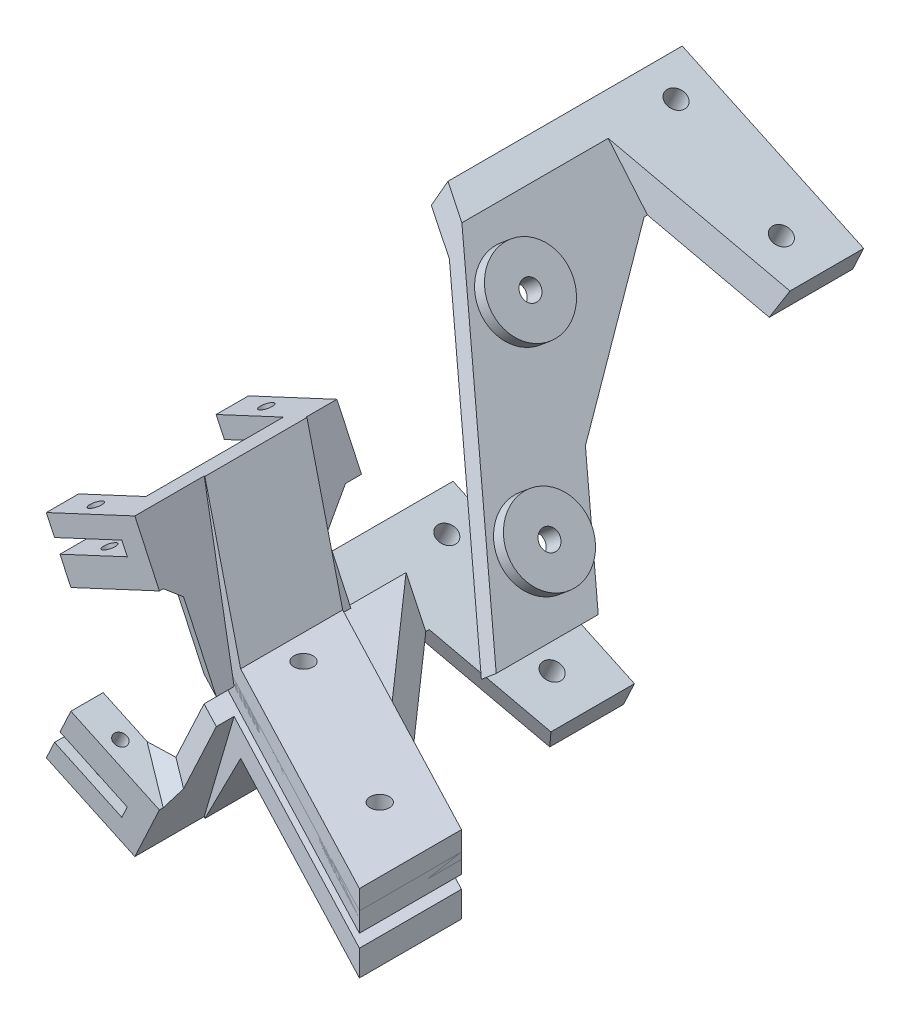
from build123d import *

# Parameters (mm, degrees)
BOSS_EXTRUDE1_DEPTH             = 3
SKETCH1_R                       = 6
BOSS_EXTRUDE3_DEPTH             = 2
SKETCH4_R                       = 1.5
CUT_EXTRUDE1_DEPTH              = 44.812962497
SKETCH5_R                       = 3.25
CUT_EXTRUDE2_DEPTH              = 2
SKETCH6_R                       = 1.5
BOSS_EXTRUDE4_DEPTH             = 4
CUT_EXTRUDE3_DEPTH              = 48.222467532
CUT_EXTRUDE3_DEPTH_BACK         = 48.222467532
SKETCH9_W                       = 15.125231148
SKETCH9_H                       = 5
SKETCH9_R                       = 1
BOSS_EXTRUDE6_DEPTH             = 4
SKETCH10_W                      = 3.625231148
SKETCH10_H                      = 31.3
BOSS_EXTRUDE7_DEPTH             = 2
SKETCH11_R                      = 1
BOSS_EXTRUDE8_DEPTH             = 3
CHAMFER2_SIZE                   = 4
CHAMFER3_SIZE                   = 2
CHAMFER4_SIZE                   = 4
CHAMFER4_SIZE_2                 = 20
BOSS_EXTRUDE9_DEPTH             = 36
BOSS_EXTRUDE9_DIRECTION_2_REACH = 51.204
SKETCH19_R                      = 3.25
CUT_EXTRUDE4_DEPTH              = 56.500838994
SKETCH20_R                      = 1.5
CUT_EXTRUDE5_DEPTH              = 56.500838994
BOSS_EXTRUDE10_DEPTH            = 11
CUT_EXTRUDE8_START              = -4
CUT_EXTRUDE8_OUTLINE_R          = 1.5
CUT_EXTRUDE8_DEPTH              = 4
CHAMFER5_SIZE                   = 5
CHAMFER5_SIZE_2                 = 12
CHAMFER6_SIZE                   = 8
CHAMFER6_SIZE_2                 = 10.199591319


# Read off the part's stored shape, not the designer's step: Cut-Extrude8
with BuildPart() as part:
    # Sketch3 → Boss-Extrude1 (new body)
    with BuildSketch(Plane(origin=(0, 0, 0), x_dir=(1, 0, 0), z_dir=(0, 1, 0))):
        Polygon((-10, 13.145588768), (-10, -2.661376867), (34.799193535, -26.145588768), (34.799193535, -10.338623133), align=None)
    extrude(amount=BOSS_EXTRUDE1_DEPTH)

    # Sketch1 → Boss-Extrude3 (add)
    with BuildSketch(Plane(origin=(0, 0, 0), x_dir=(1, 0, 0), z_dir=(0, 1, 0))):
        with Locations(Location((0, 0, 0), (0, 0, 270))):
            Circle(SKETCH1_R)
        with Locations(Location((24.799193535, -13, 0), (0, 0, 270))):
            Circle(SKETCH1_R)
    extrude(amount=-BOSS_EXTRUDE3_DEPTH)

    # Sketch4 → Cut-Extrude1 (cut, through all)
    with BuildSketch(Plane(origin=(0, 3, 0), x_dir=(1, 0, 0), z_dir=(0, 1, 0))):
        with Locations(Location((0, 0, 0), (0, 0, 270))):
            Circle(SKETCH4_R)
        with Locations(Location((24.799193535, -13, 0), (0, 0, 270))):
            Circle(SKETCH4_R)
    extrude(amount=-CUT_EXTRUDE1_DEPTH, mode=Mode.SUBTRACT)

    # Sketch5 → Cut-Extrude2 (cut)
    with BuildSketch(Plane(origin=(0, 3, 0), x_dir=(1, 0, 0), z_dir=(0, 1, 0))):
        with Locations(Location((0, 0, 0), (0, 0, 270))):
            Circle(SKETCH5_R)
        with Locations(Location((24.799193535, -13, 0), (0, 0, 270))):
            Circle(SKETCH5_R)
    extrude(amount=-CUT_EXTRUDE2_DEPTH, mode=Mode.SUBTRACT)

    # Sketch18 → Boss-Extrude9 (add)
    with BuildSketch(Plane.XY):
        Polygon((-10, 0), (-14.531538935, 2.113091309), (-12.841065888, 5.738322457), (-0.535193667, 0), align=None)
    extrude(amount=-BOSS_EXTRUDE9_DEPTH)

    # Boss-Extrude9 direction 2: up to this plane
    boss_extrude9_direction_2_end = Plane(origin=(-10, 3, 2.661376867), z_dir=(0.4642857142857141, 0, -0.8856854834026605))
    # Sketch18 → Boss-Extrude9 direction 2 (add, up to the surface)
    with BuildSketch(Plane.XY, mode=Mode.PRIVATE) as boss_extrude9_direction_2_sk1:
        Polygon((-10, 0), (-14.531538935, 2.113091309), (-12.841065888, 5.738322457), (-0.535193667, 0), align=None)
    boss_extrude9_direction_2_tool1 = split(extrude(boss_extrude9_direction_2_sk1.sketch, amount=BOSS_EXTRUDE9_DIRECTION_2_REACH, mode=Mode.PRIVATE), bisect_by=boss_extrude9_direction_2_end, keep=Keep.BOTH, mode=Mode.PRIVATE)
    add(boss_extrude9_direction_2_tool1.solids().sort_by_distance((-9.047723, 2.102343, 0))[0])

    # Sketch19 → Cut-Extrude4 (cut, through all)
    with BuildSketch(Plane(origin=(0, 1, 0), x_dir=(1, 0, 0), z_dir=(0, 1, 0))):
        with Locations(Location((0, 0, 0), (0, 0, 270))):
            Circle(SKETCH19_R)
    extrude(amount=CUT_EXTRUDE4_DEPTH, mode=Mode.SUBTRACT)

    # Sketch20 → Cut-Extrude5 (cut, through all)
    with BuildSketch(Plane(origin=(0, 1, 0), x_dir=(1, 0, 0), z_dir=(0, 1, 0))):
        with Locations(Location((0, 0, 0), (0, 0, 90))):
            Circle(SKETCH20_R)
    extrude(amount=-CUT_EXTRUDE5_DEPTH, mode=Mode.SUBTRACT)

    # Sketch21 → Boss-Extrude10 (add, through all)
    with BuildSketch(Plane.XY.offset(-25)):
        Polygon((-0.535193667, 0), (15.25447551, -7.362843657), (13.564002463, -10.988074805), (-10, 0), align=None)
    extrude(amount=-BOSS_EXTRUDE10_DEPTH)

    # Cut-Extrude8 outline → Cut-Extrude8 (cut)
    with BuildSketch(Plane(origin=(-1.786061952, -3.830222216, 0), x_dir=(0.9063077870366528, -0.4226182617406934, 0), z_dir=(-0.4226182617406934, -0.9063077870366528, 0)).offset(CUT_EXTRUDE8_START)):
        with Locations((-9.06307787, -30.5)):
            Circle(CUT_EXTRUDE8_OUTLINE_R)
        with Locations((10.860816091, -28.756885145)):
            Circle(CUT_EXTRUDE8_OUTLINE_R)
    extrude(amount=CUT_EXTRUDE8_DEPTH, mode=Mode.SUBTRACT)

    # Chamfer5
    # the kernel refuses this chamfer: 12, 5 mm, written as the material it adds along each edge
    with BuildSketch(Plane(origin=(-41.111115995, 0, -25), x_dir=(0, 0.08514956558962705, 0.9963681806841774), z_dir=(1, 0, 0))) as chamfer5_piece_1_section:
        Polygon((CHAMFER5_SIZE * 0.996368180684, CHAMFER5_SIZE * 0.0851495655896), (-CHAMFER5_SIZE_2 * 0.0851495655896, CHAMFER5_SIZE_2 * 0.996368180684), (0, 0), align=None)
    chamfer5_piece_1 = extrude(amount=71.687038323, mode=Mode.PRIVATE)
    chamfer5_piece_1 = split(chamfer5_piece_1, bisect_by=Plane(origin=(1.550297343, -5.385992105, -23.254006198), z_dir=(0.42261826174069345, 0.9063077870366528, 0)), keep=Keep.TOP, mode=Mode.PRIVATE)
    chamfer5_piece_1 = split(chamfer5_piece_1, bisect_by=Plane(origin=(3.24077039, -1.760760957, -23.254006198), z_dir=(-0.4226182617406936, -0.9063077870366527, 0)), keep=Keep.TOP, mode=Mode.PRIVATE)
    chamfer5_piece_1 = split(chamfer5_piece_1, bisect_by=Plane(origin=(14.387857278, -9.221312453, -23.254006198), z_dir=(-0.9063077870366527, 0.42261826174069367, 0)), keep=Keep.TOP, mode=Mode.PRIVATE)
    add(chamfer5_piece_1)

    # Chamfer6
    # the kernel refuses this chamfer: 10.199591319, 8 mm, written as the material it adds along each edge
    with BuildSketch(Plane(origin=(-28.542352588, 13.059952688, -22.865686452), x_dir=(0.3217356763825724, 0.9237156304588676, 0.20793169212177692), z_dir=(0.8186169306793456, -0.381727343871112, 0.42912766835317584))) as chamfer6_piece_1_section:
        Polygon((CHAMFER6_SIZE * 0.999394825625, -CHAMFER6_SIZE * 0.0347848029311), (-CHAMFER6_SIZE_2 * 0.230205490119, -CHAMFER6_SIZE_2 * 0.97314204121), (0, 0), align=None)
    chamfer6_piece_1 = extrude(amount=60.566542446, mode=Mode.PRIVATE)
    chamfer6_piece_1 = split(chamfer6_piece_1, bisect_by=Plane(origin=(2.435257829, 0, -10.390954579), z_dir=(0, 1, 0)), keep=Keep.TOP, mode=Mode.PRIVATE)
    chamfer6_piece_1 = split(chamfer6_piece_1, bisect_by=Plane(origin=(2.435257829, 3, -10.390954579), z_dir=(0, -1, 0)), keep=Keep.TOP, mode=Mode.PRIVATE)
    add(chamfer6_piece_1)


with BuildPart() as body_2:
    # Sketch6 → Boss-Extrude4 (new body)
    with BuildSketch(Plane.XZ.offset(2)):
        Polygon((-10, 2.661376867), (-10, -13.145588768), (34.799193535, 10.338623133), (34.799193535, 26.145588768), align=None)
        with Locations(Location((0, 0, 0), (0, 0, 270))):
            Circle(SKETCH6_R, mode=Mode.SUBTRACT)
        with Locations(Location((24.799193535, 13, 0), (0, 0, 270))):
            Circle(SKETCH6_R, mode=Mode.SUBTRACT)
    extrude(amount=BOSS_EXTRUDE4_DEPTH)

    # Sketch16 → Loft1 section 0
    with BuildSketch(Plane(origin=(0, -18.313540167, 0), x_dir=(-1, 0, 0), z_dir=(0, -1, 0))):
        with BuildLine():
            Line((13.607128711, -7.50473643), (13.607128711, 13.79526357))
            Line((13.607128711, 13.79526357), (17.607128711, 15.892105951))
            Line((17.607128711, 15.892105951), (17.607128711, -5.407894049))
            Line((17.607128711, -5.407894049), (13.607128711, -7.50473643))
        make_face()
    # Sketch7 → Loft1 section 1
    with BuildSketch(Plane(origin=(0, -2, 0), x_dir=(1, 0, 0), z_dir=(0, 1, 0))):
        with BuildLine():
            Line((-10, 15.892105951), (-10, -5.407894049))
            Line((-10, -5.407894049), (-6, -7.50473643))
            Line((-6, -7.50473643), (-6, 13.79526357))
            Line((-6, 13.79526357), (-10, 15.892105951))
        make_face()
    loft()

    # Sketch17 → Cut-Extrude3 (cut, two sides: drawn at the far end of the back side and taken through both)
    with BuildSketch(Plane.XY.offset(-CUT_EXTRUDE3_DEPTH_BACK)):
        Polygon((-17.607128711, -18.313540167), (-13.607128711, -18.313540167), (-16.892703931, -16.78145128), align=None)
    extrude(amount=CUT_EXTRUDE3_DEPTH + CUT_EXTRUDE3_DEPTH_BACK, mode=Mode.SUBTRACT)

    # Sketch9 → Boss-Extrude6 (add)
    # profile 1 of 2: a face of its own
    with BuildSketch(Plane(origin=(-26.705419865, -12.205706693, 0), x_dir=(-0.9063077870366525, 0.42261826174069417, 0), z_dir=(0.4226182617406941, 0.9063077870366524, 0))):
        with Locations((-6.889749661, 7.907894049)):
            Rectangle(SKETCH9_W, SKETCH9_H)
        with Locations(Location((-5.077134087, 7.957894049, 0), (0, 0, 180))):
            Circle(SKETCH9_R, mode=Mode.SUBTRACT)
    # profile 2 of 2: a face of its own
    with BuildSketch(Plane(origin=(-26.705419865, -12.205706693, 0), x_dir=(-0.9063077870366525, 0.42261826174069417, 0), z_dir=(0.4226182617406941, 0.9063077870366524, 0))):
        Polygon((-10.827134087, -15.892105951), (0.672865913, -15.892105951), (0.672865913, -20.892105951), (-14.452365235, -20.892105951), (-14.452365235, -15.892105951), (-14.452365235, -13.79526357), align=None)
        with Locations(Location((-5.077134087, -18.442105951, 0), (0, 0, 180))):
            Circle(SKETCH9_R, mode=Mode.SUBTRACT)
    extrude(amount=BOSS_EXTRUDE6_DEPTH)

    # Sketch10 → Boss-Extrude7 (add)
    with BuildSketch(Plane(origin=(-50.114461272, -1.289891415, 0), x_dir=(-0.9063077870366525, 0.42261826174069417, 0), z_dir=(0.4226182617406941, 0.9063077870366524, 0))):
        with Locations((-38.468769054, -5.242105951)):
            Rectangle(SKETCH10_W, SKETCH10_H)
    extrude(amount=-BOSS_EXTRUDE7_DEPTH)

    # Sketch11 → Boss-Extrude8 (add)
    with BuildSketch(Plane(origin=(-10.290046849, -22.06707668, 0), x_dir=(0.9063077870366528, -0.4226182617406936, 0), z_dir=(-0.4226182617406936, -0.9063077870366528, 0))):
        Polygon((-19.717841347, 10.407894049), (-4.592610199, 10.407894049), (-4.592610199, -20.892105951), (-19.717841347, -20.892105951), (-19.717841347, -15.892105951), (-8.217841347, -15.892105951), (-8.217841347, 5.407894049), (-19.717841347, 5.407894049), align=None)
        with Locations((-13.967841347, -18.442105951)):
            Circle(SKETCH11_R, mode=Mode.SUBTRACT)
        with Locations((-13.967841347, 7.957894049)):
            Circle(SKETCH11_R, mode=Mode.SUBTRACT)
    extrude(amount=BOSS_EXTRUDE8_DEPTH)

    # Chamfer2
    # the kernel refuses this chamfer: 4 mm, written as the material it adds along each edge
    with BuildSketch(Plane(origin=(-3.8464274, -18.451518261, -8.644872691), x_dir=(0.4419809959760686, -0.23643746629724946, -0.8653034864872206), z_dir=(-0.7845279046867107, 0.36583136999170246, -0.5006829091329899))) as chamfer2_piece_1_section:
        Polygon((CHAMFER2_SIZE * 0.999621916911, -CHAMFER2_SIZE * 0.0274958766106), (-CHAMFER2_SIZE * 0.0274958766106, -CHAMFER2_SIZE * 0.999621916911), (0, 0), align=None)
    chamfer2_piece_1 = extrude(amount=24.761428665, mode=Mode.PRIVATE)
    chamfer2_piece_1 = split(chamfer2_piece_1, bisect_by=Plane(origin=(-11.168720037, -13.084355891, -15.118782346), z_dir=(-0.9063077870366527, 0.4226182617406936, 0)), keep=Keep.TOP, mode=Mode.PRIVATE)
    chamfer2_piece_1 = split(chamfer2_piece_1, bisect_by=Plane(origin=(-14.454295257, -11.552267004, -15.118782346), z_dir=(0.9063077870366528, -0.4226182617406935, 0)), keep=Keep.TOP, mode=Mode.PRIVATE)
    add(chamfer2_piece_1)

    # Chamfer3
    # the kernel refuses this chamfer: 2 mm, written as the material it adds along each edge
    with BuildSketch(Plane(origin=(-7.881541532, -16.56991364, 10.079931869), x_dir=(0.43493535837395614, 0.900147062018719, -0.023801276755393234), z_dir=(-0.7845279046867109, 0.36583136999170235, -0.5006829091329895))) as chamfer3_piece_1_section:
        Polygon((CHAMFER3_SIZE * 0.999621916911, -CHAMFER3_SIZE * 0.0274958766106), (-CHAMFER3_SIZE * 0.0274958766106, -CHAMFER3_SIZE * 0.999621916911), (0, 0), align=None)
    chamfer3_piece_1 = extrude(amount=14.474696714, mode=Mode.PRIVATE)
    chamfer3_piece_1 = split(chamfer3_piece_1, bisect_by=Plane(origin=(-11.638128642, -14.091005892, 7.219593403), z_dir=(-0.9063077870365974, 0.42261826174081224, 0)), keep=Keep.TOP, mode=Mode.PRIVATE)
    chamfer3_piece_1 = split(chamfer3_piece_1, bisect_by=Plane(origin=(-14.923703861, -12.558917005, 7.219593403), z_dir=(0.9063077870365974, -0.42261826174081224, 0)), keep=Keep.TOP, mode=Mode.PRIVATE)
    chamfer3_piece_1 = split(chamfer3_piece_1, bisect_by=Plane(origin=(-13.279775159, -13.325493549, 5.407894049), z_dir=(0, 0, 1)), keep=Keep.TOP, mode=Mode.PRIVATE)
    add(chamfer3_piece_1)
    with BuildSketch(Plane(origin=(-7.881541532, -16.56991364, 10.079931869), x_dir=(0.43493535837395614, 0.900147062018719, -0.023801276755393234), z_dir=(-0.7845279046867109, 0.36583136999170235, -0.5006829091329895))) as chamfer3_piece_2_section:
        Polygon((CHAMFER3_SIZE * 0.999621916911, -CHAMFER3_SIZE * 0.0274958766106), (-CHAMFER3_SIZE * 0.0274958766106, -CHAMFER3_SIZE * 0.999621916911), (0, 0), align=None)
    chamfer3_piece_2 = extrude(amount=14.474696714, mode=Mode.PRIVATE)
    chamfer3_piece_2 = split(chamfer3_piece_2, bisect_by=Plane(origin=(-15.009693587, -12.743322567, 6.010096265), z_dir=(-0.9063077870365974, 0.42261826174081224, 0)), keep=Keep.TOP, mode=Mode.PRIVATE)
    chamfer3_piece_2 = split(chamfer3_piece_2, bisect_by=Plane(origin=(-15.953293685, -12.303314615, 5.407894049), z_dir=(0, 0, 1)), keep=Keep.TOP, mode=Mode.PRIVATE)
    add(chamfer3_piece_2)

    # Chamfer4
    # the kernel refuses this chamfer: 20, 4 mm, written as the material it adds along each edge
    with BuildSketch(Plane(origin=(-7.865230633, -6, -64.000203695), x_dir=(0.9892134397382245, 0.14648129792321618, 0), z_dir=(0, 0, 1))) as chamfer4_piece_1_section:
        Polygon((CHAMFER4_SIZE * 0.989213439738, -CHAMFER4_SIZE * 0.146481297923), (-CHAMFER4_SIZE_2 * 0.550816805356, -CHAMFER4_SIZE_2 * 0.83462617197), (0, 0), align=None)
    chamfer4_piece_1 = extrude(amount=119.75433293, mode=Mode.PRIVATE)
    chamfer4_piece_1 = split(chamfer4_piece_1, bisect_by=Plane(origin=(-17.061497647, -14.46567413, -1.040335016), z_dir=(0.4642857142857141, 0, -0.8856854834026604)), keep=Keep.TOP, mode=Mode.PRIVATE)
    chamfer4_piece_1 = split(chamfer4_piece_1, bisect_by=Plane(origin=(-10.561497647, -14.46567413, -13.439931784), z_dir=(-0.4642857142857143, 0, 0.8856854834026603)), keep=Keep.TOP, mode=Mode.PRIVATE)
    chamfer4_piece_1 = split(chamfer4_piece_1, bisect_by=Plane(origin=(-14.743147871, -23.300695327, -13.322016998), z_dir=(0.4226182617406936, 0.9063077870366527, 0)), keep=Keep.TOP, mode=Mode.PRIVATE)
    add(chamfer4_piece_1)


with BuildPart() as body_3:
    # Mirror1: mirrored copy
    add(body_2.part.mirror(Plane.ZX))


with BuildPart() as body_4:
    # Mirror2: mirrored copy
    add(part.part.mirror(Plane(origin=(16.809141565, 36.047320414, 0), x_dir=(0, 0, 1), z_dir=(0.4226182617406937, 0.9063077870366527, 0))))


solid = Compound([part.part, body_2.part, body_3.part, body_4.part])
